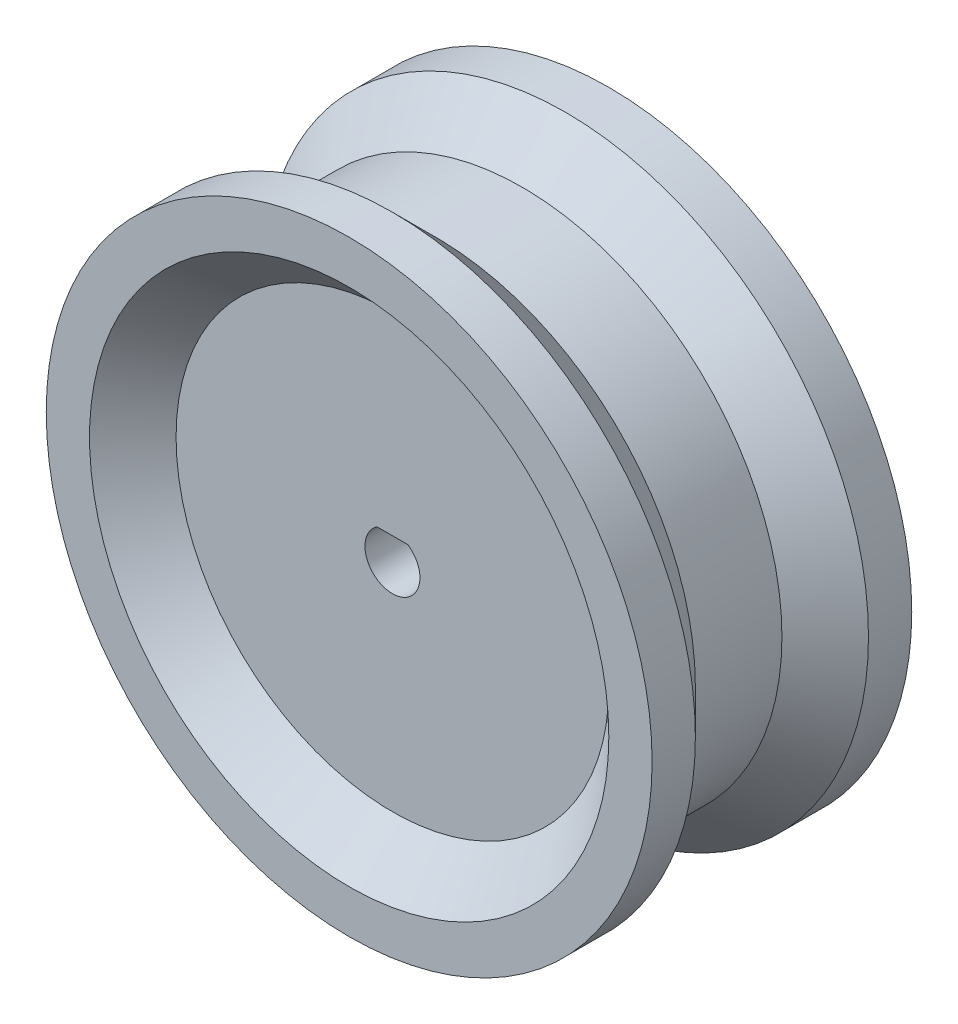
from build123d import *

# Parameters (mm, degrees)
SKETCH1_R           = 35
BOSS_EXTRUDE1_DEPTH = 30
SKETCH3_R           = 25
CUT_EXTRUDE1_DEPTH  = 5
CUT_EXTRUDE2_START  = -5
SKETCH4_R           = 25
CUT_EXTRUDE2_DEPTH  = 5
CUT_EXTRUDE3_DEPTH  = 39
CHAMFER2_SIZE       = 5


with BuildPart() as part:
    # Sketch1 → Boss-Extrude1 (new body)
    with BuildSketch(Plane.XY):
        Circle(SKETCH1_R)
    extrude(amount=BOSS_EXTRUDE1_DEPTH)

    # Sketch3 → Cut-Extrude1 (cut)
    with BuildSketch(Plane.XY.offset(30)):
        Circle(SKETCH3_R)
    extrude(amount=-CUT_EXTRUDE1_DEPTH, mode=Mode.SUBTRACT)

    # Sketch4 → Cut-Extrude2 (cut)
    with BuildSketch(Plane(origin=(0, 0, 0), x_dir=(-1, 0, 0), z_dir=(0, 0, -1)).offset(CUT_EXTRUDE2_START)):
        with Locations(Location((0, 0, 0), (0, 0, 180))):
            Circle(SKETCH4_R)
    extrude(amount=CUT_EXTRUDE2_DEPTH, mode=Mode.SUBTRACT)

    # Sketch5 → Cut-Revolve1 (revolve, cut)
    with BuildSketch(Plane(origin=(0, 0, 0), x_dir=(0, 0, -1), z_dir=(1, 0, 0)), mode=Mode.PRIVATE) as cut_revolve1_sk:
        Polygon((-25, 35), (-20, 30), (-10, 30), (-5, 35), align=None)
    revolve(cut_revolve1_sk.sketch.rotate(Axis((0, 0, 49.767686579), (0, 0, -1)), 90), axis=Axis((0, 0, 49.767686579), (0, 0, -1)), mode=Mode.SUBTRACT)

    # Sketch6 → Cut-Extrude3 (cut)
    with BuildSketch(Plane.XY.offset(25)):
        with BuildLine():
            Line((-1.78605711, 2.625), (1.78605711, 2.625))
            ThreePointArc((1.78605711, 2.625), (0, -3.175), (-1.78605711, 2.625))
        make_face()
    extrude(amount=-CUT_EXTRUDE3_DEPTH, mode=Mode.SUBTRACT)

    # Chamfer2
    chamfer2_edges = [part.edges().sort_by_distance(p)[0] for p in [
        (-25, 0, 0),
        (-25, 0, 30),
    ]]
    chamfer(chamfer2_edges, length=CHAMFER2_SIZE - 0.0001)  # a hair under: the kernel refuses the full size


solid = part.part
